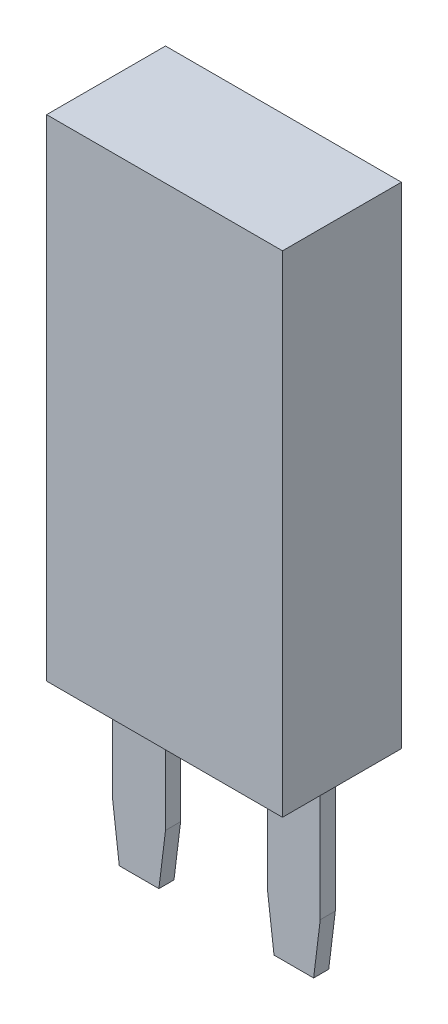
from build123d import *
from OCP.BRepFilletAPI import BRepFilletAPI_MakeChamfer

# Parameters (mm, degrees)
SKETCH1_W           = 12.5
SKETCH1_H           = 26
BOSS_EXTRUDE1_DEPTH = 3.15
SKETCH2_W           = 2.8
SKETCH2_H           = 0.8
BOSS_EXTRUDE2_DEPTH = 9.3
CHAMFER1_SIZE       = 0.35
CHAMFER1_SIZE2      = 2.85052125


with BuildPart() as part:
    # Sketch1 → Boss-Extrude1 (new, symmetric)
    with BuildSketch(Plane.XY):
        Rectangle(SKETCH1_W, SKETCH1_H)
    extrude(amount=BOSS_EXTRUDE1_DEPTH, both=True)

    # Sketch2 → Boss-Extrude2 (add)
    with BuildSketch(Plane.XZ.offset(13)):
        with Locations((4.1, 0)):
            Rectangle(SKETCH2_W, SKETCH2_H)
        with Locations((-4.1, 0)):
            Rectangle(SKETCH2_W, SKETCH2_H)
    extrude(amount=BOSS_EXTRUDE2_DEPTH)

    # Chamfer1: one chamfer whose edges measure the first distance from different faces: ONE call of the kernel's chamfer builder (chamfer() names one face for all edges)
    chamfer1_edges_1 = [part.edges().sort_by_distance(p)[0] for p in [
        (5.5, -22.3, 0),
        (2.7, -22.3, 0),
    ]]
    chamfer1_side_1 = [part.faces().sort_by_distance(p)[0] for p in [
        (4.1, -22.3, 0),
    ]]
    chamfer1_edges_2 = [part.edges().sort_by_distance(p)[0] for p in [
        (-2.7, -22.3, 0),
        (-5.5, -22.3, 0),
    ]]
    chamfer1_side_2 = [part.faces().sort_by_distance(p)[0] for p in [
        (-4.1, -22.3, 0),
    ]]
    chamfer1 = BRepFilletAPI_MakeChamfer(part.part.solid().wrapped)
    for e in chamfer1_edges_1:
        chamfer1.Add(CHAMFER1_SIZE, CHAMFER1_SIZE2, e.wrapped, chamfer1_side_1[0].wrapped)  # the first distance lies on this face
    for e in chamfer1_edges_2:
        chamfer1.Add(CHAMFER1_SIZE, CHAMFER1_SIZE2, e.wrapped, chamfer1_side_2[0].wrapped)  # the first distance lies on this face
    add(Compound.cast(chamfer1.Shape()), mode=Mode.REPLACE)


solid = part.part
